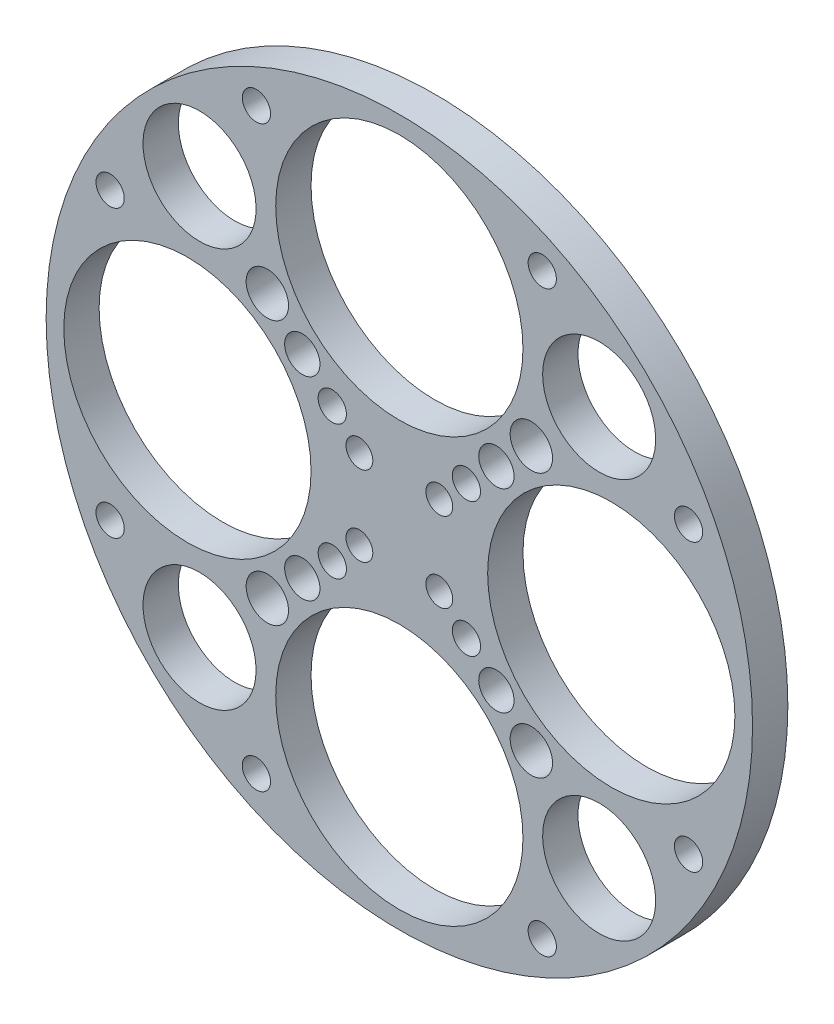
from build123d import *

# Parameters (mm, degrees)
SKETCH1_R           = 50
BOSS_EXTRUDE1_DEPTH = 5
SKETCH2_R           = 1.9
CUT_EXTRUDE1_DEPTH  = 71.887234394
CIRPATTERN1_COUNT   = 4
SKETCH3_R           = 17.5
CUT_EXTRUDE2_DEPTH  = 71.887234394
CIRPATTERN2_COUNT   = 4
SKETCH4_R           = 8
SKETCH4_R_2         = 3
SKETCH4_R_3         = 2.5
SKETCH4_R_4         = 2
CUT_EXTRUDE3_DEPTH  = 71.887234394
CIRPATTERN3_COUNT   = 4


with BuildPart() as part:
    # Sketch1 → Boss-Extrude1 (new body)
    with BuildSketch(Plane.XY):
        Circle(SKETCH1_R)
    extrude(amount=BOSS_EXTRUDE1_DEPTH)

    # Sketch2 → Cut-Extrude1 (cut, through all)
    with BuildSketch(Plane(origin=(0, 0, 0), x_dir=(-1, 0, 0), z_dir=(0, 0, -1))):
        with Locations((-5.656854249, 5.656854249)):
            Circle(SKETCH2_R)
    cut_extrude1 = extrude(amount=-CUT_EXTRUDE1_DEPTH, mode=Mode.SUBTRACT)

    # CirPattern1: Cut-Extrude1 ×4 about axis
    cirpattern1_axis = Axis((0, 0, 5), (0, 0, -1))
    for i in range(1, CIRPATTERN1_COUNT):
        add(cut_extrude1.rotate(cirpattern1_axis, i * 360 / CIRPATTERN1_COUNT), mode=Mode.SUBTRACT)

    # Sketch3 → Cut-Extrude2 (cut, through all)
    with BuildSketch(Plane(origin=(0, 0, 0), x_dir=(-1, 0, 0), z_dir=(0, 0, -1))):
        with Locations((0, 30)):
            Circle(SKETCH3_R)
    cut_extrude2 = extrude(amount=-CUT_EXTRUDE2_DEPTH, mode=Mode.SUBTRACT)

    # CirPattern2: Cut-Extrude2 ×4 about axis
    cirpattern2_axis = Axis((0, 0, 5), (0, 0, -1))
    for i in range(1, CIRPATTERN2_COUNT):
        add(cut_extrude2.rotate(cirpattern2_axis, i * 360 / CIRPATTERN2_COUNT), mode=Mode.SUBTRACT)

    # Sketch4 → Cut-Extrude3 (cut, through all)
    with BuildSketch(Plane(origin=(0, 0, 0), x_dir=(-1, 0, 0), z_dir=(0, 0, -1))):
        with Locations((-28.284271247, 28.284271247)):
            Circle(SKETCH4_R)
        with Locations((-18.686291501, 18.686291501)):
            Circle(SKETCH4_R_2)
        with Locations((-13.736544033, 13.736544033)):
            Circle(SKETCH4_R_3)
        with Locations((-9.493903346, 9.493903346)):
            Circle(SKETCH4_R_4)
        with Locations((-20.231783609, 40.939603832)):
            Circle(SKETCH4_R_4)
        with Locations((-40.939603832, 20.231783609)):
            Circle(SKETCH4_R_4)
    cut_extrude3 = extrude(amount=-CUT_EXTRUDE3_DEPTH, mode=Mode.SUBTRACT)

    # CirPattern3: Cut-Extrude3 ×4 about axis
    cirpattern3_axis = Axis((0, 0, 5), (0, 0, -1))
    for i in range(1, CIRPATTERN3_COUNT):
        add(cut_extrude3.rotate(cirpattern3_axis, i * 360 / CIRPATTERN3_COUNT), mode=Mode.SUBTRACT)


solid = part.part
